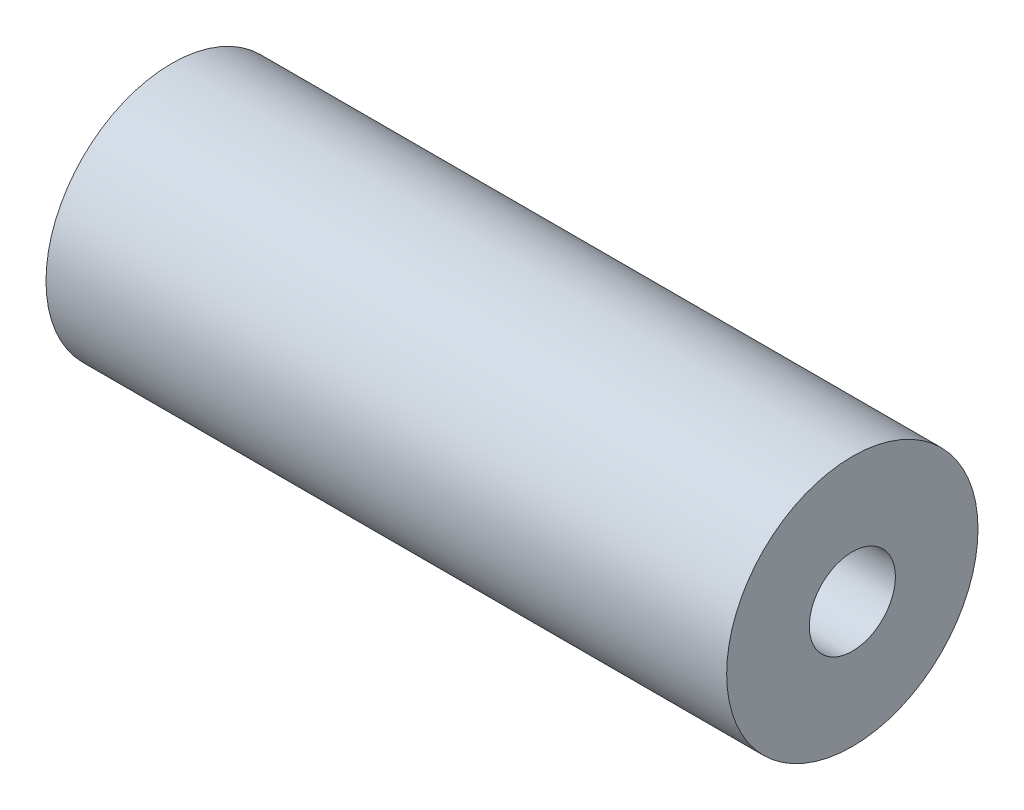
from build123d import *

# Parameters (mm, degrees)
SKETCH1_R           = 9.525
SKETCH1_R_2         = 3.2639
BOSS_EXTRUDE1_DEPTH = 51.59375


with BuildPart() as part:
    # Sketch1 → Boss-Extrude1 (new body)
    with BuildSketch(Plane(origin=(0, 0, 0), x_dir=(0, 0, -1), z_dir=(1, 0, 0))):
        Circle(SKETCH1_R)
        Circle(SKETCH1_R_2, mode=Mode.SUBTRACT)
    extrude(amount=BOSS_EXTRUDE1_DEPTH)


solid = part.part
